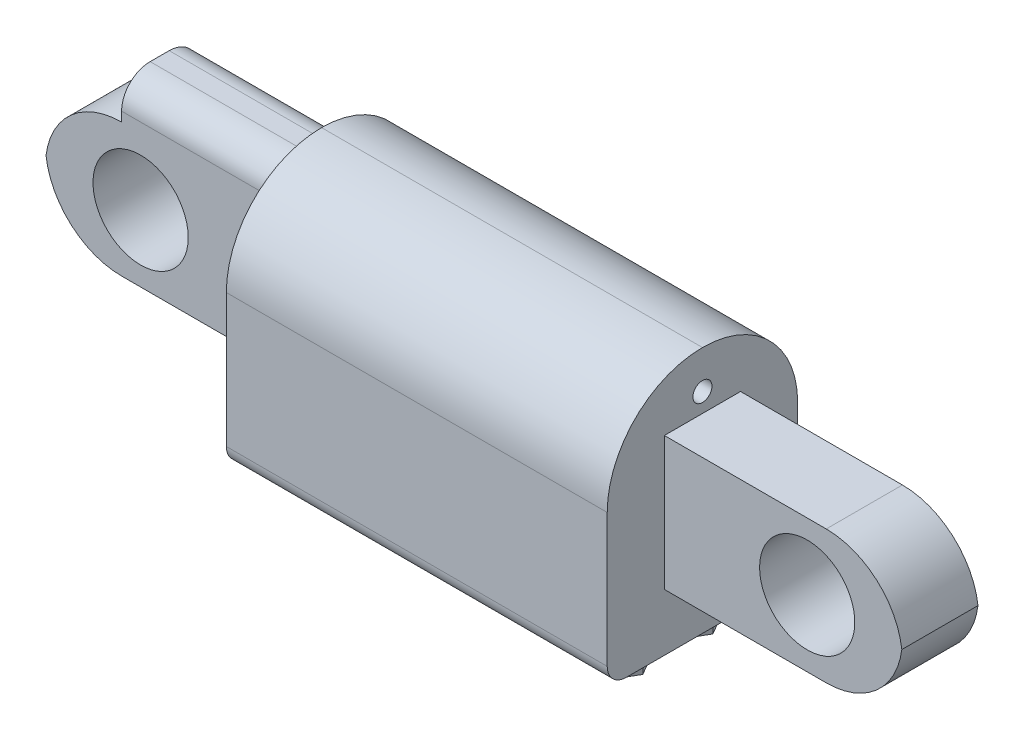
from build123d import *

# Parameters (mm, degrees)
SKETCH1_W           = 15.875
SKETCH1_H           = 8.89
SKETCH1_R           = 3.175
BOSS_EXTRUDE1_DEPTH = 5.08
FILLET1_R           = 5.08
SKETCH2_W           = 12.7
SKETCH2_H           = 16.51
SKETCH2_W_2         = 5.08
SKETCH2_H_2         = 8.89
BOSS_EXTRUDE2_DEPTH = 25.4
FILLET3_R           = 6.35
SKETCH3_W           = 10.795
SKETCH3_H           = 5.08
BOSS_EXTRUDE3_DEPTH = 2.54
SKETCH4_R           = 0.635
CUT_EXTRUDE1_DEPTH  = 54.425782953
FILLET6_R           = 1.27
BOSS_EXTRUDE7_DEPTH = 0.381
FILLET7_R           = 1.905


# Some blends are built 0.0001 mm under size
with BuildPart() as part:
    # Sketch1 → Boss-Extrude1 (new body)
    with BuildSketch(Plane.XY):
        with Locations((1.5875, 0)):
            Rectangle(SKETCH1_W, SKETCH1_H)
        Circle(SKETCH1_R, mode=Mode.SUBTRACT)
    extrude(amount=BOSS_EXTRUDE1_DEPTH)

    # Fillet1
    # the kernel refuses this fillet: 5.08 mm, written as the material it takes off along each edge
    with BuildSketch(Plane(origin=(-6.35, -4.445, -12.7), x_dir=(1, 0, 0), z_dir=(0, 0, 1))) as fillet1_piece_1:
        with BuildLine():
            CenterArc((FILLET1_R, FILLET1_R), FILLET1_R, 180, 90)
            Line((0, FILLET1_R), (0, 0))
            Line((0, 0), (FILLET1_R, 0))
        make_face()
    extrude(amount=30.48, mode=Mode.SUBTRACT)
    with BuildSketch(Plane(origin=(-6.35, 4.445, -12.7), x_dir=(1, 0, 0), z_dir=(0, 0, 1))) as fillet1_piece_2:
        with BuildLine():
            CenterArc((FILLET1_R, -FILLET1_R), FILLET1_R, 90, 90)
            Line((0, -FILLET1_R), (0, 0))
            Line((0, 0), (FILLET1_R, 0))
        make_face()
    extrude(amount=30.48, mode=Mode.SUBTRACT)


with BuildPart() as body_2:
    # Sketch2 → Boss-Extrude2 (new body)
    # profile 1 of 3: a face of its own
    with BuildSketch(Plane(origin=(9.525, 0, 0), x_dir=(0, 0, -1), z_dir=(1, 0, 0))):
        with Locations((-2.54, 0)):
            Rectangle(SKETCH2_W, SKETCH2_H)
        with Locations((-2.54, 0)):
            Rectangle(SKETCH2_W_2, SKETCH2_H_2, mode=Mode.SUBTRACT)
    # profile 2 of 3: a face of its own
    with BuildSketch(Plane(origin=(9.525, 0, 0), x_dir=(0, 0, -1), z_dir=(1, 0, 0))):
        with Locations((-2.54, 0)):
            Rectangle(SKETCH2_W_2, SKETCH2_H_2)
    # profile 3 of 3: a face of its own
    with BuildSketch(Plane(origin=(9.525, 0, 0), x_dir=(0, 0, -1), z_dir=(1, 0, 0))):
        with Locations((-2.54, 0)):
            Rectangle(SKETCH2_W_2, SKETCH2_H_2)
    extrude(amount=BOSS_EXTRUDE2_DEPTH)

    # Fillet3
    fillet3_edges = [body_2.edges().sort_by_distance(p)[0] for p in [
        (22.225, 8.255, -3.81),
        (22.225, 8.255, 8.89),
    ]]
    fillet(fillet3_edges, radius=FILLET3_R - 0.0001)  # a hair under: the kernel refuses the full size


with BuildPart() as body_3:
    # Mirror7: mirrored copy
    add(part.part.mirror(Plane.ZY.offset(-22.225)))


with BuildPart() as part_1:
    add(part.part)

    add(body_2.part)  # Boss-Extrude3 merges body 2
    # Sketch3 → Boss-Extrude3 (add)
    with BuildSketch(Plane(origin=(0, 4.445, 0), x_dir=(1, 0, 0), z_dir=(0, 1, 0))):
        with Locations((4.1275, -2.54)):
            Rectangle(SKETCH3_W, SKETCH3_H)
    extrude(amount=BOSS_EXTRUDE3_DEPTH)

    # Sketch4 → Cut-Extrude1 (cut, through all)
    with BuildSketch(Plane.ZY.offset(1.27)):
        with Locations(Location((2.54, 5.715, 0), (0, 0, 270))):
            Circle(SKETCH4_R)
    extrude(amount=-CUT_EXTRUDE1_DEPTH, mode=Mode.SUBTRACT)

    # Fillet6
    fillet6_edges = [part_1.edges().sort_by_distance(p)[0] for p in [
        (22.225, -8.255, 8.89),
        (22.225, -8.255, -3.81),
    ]]
    fillet(fillet6_edges, radius=FILLET6_R)

    # Sketch5 → Boss-Extrude7 (add)
    with BuildSketch(Plane.XZ.offset(8.255)):
        Polygon((34.925, 6.520147737), (34.29, 7.62), (33.02, 7.62), (32.385, 6.520147737), (33.02, 5.420295474), (34.29, 5.420295474), align=None)
        Polygon((29.845, 6.520147737), (29.21, 7.62), (27.94, 7.62), (27.305, 6.520147737), (27.94, 5.420295474), (29.21, 5.420295474), align=None)
        Polygon((24.765, 6.520147737), (24.13, 7.62), (22.86, 7.62), (22.225, 6.520147737), (22.86, 5.420295474), (24.13, 5.420295474), align=None)
        Polygon((19.685, 6.520147737), (19.05, 7.62), (17.78, 7.62), (17.145, 6.520147737), (17.78, 5.420295474), (19.05, 5.420295474), align=None)
        Polygon((14.605, 6.520147737), (13.97, 7.62), (12.7, 7.62), (12.065, 6.520147737), (12.7, 5.420295474), (13.97, 5.420295474), align=None)
        Polygon((30.48, 3.083495474), (31.75, 3.083495474), (32.385, 4.183347737), (31.75, 5.2832), (30.48, 5.2832), (29.845, 4.183347737), align=None)
        Polygon((25.4, 3.083495474), (26.67, 3.083495474), (27.305, 4.183347737), (26.67, 5.2832), (25.4, 5.2832), (24.765, 4.183347737), align=None)
        Polygon((20.32, 3.083495474), (21.59, 3.083495474), (22.225, 4.183347737), (21.59, 5.2832), (20.32, 5.2832), (19.685, 4.183347737), align=None)
        Polygon((15.24, 3.083495474), (16.51, 3.083495474), (17.145, 4.183347737), (16.51, 5.2832), (15.24, 5.2832), (14.605, 4.183347737), align=None)
        Polygon((10.16, 3.083495474), (11.43, 3.083495474), (12.065, 4.183347737), (11.43, 5.2832), (10.16, 5.2832), (9.525, 4.183347737), align=None)
        Polygon((33.02, 0.746695474), (34.29, 0.746695474), (34.925, 1.846547737), (34.29, 2.9464), (33.02, 2.9464), (32.385, 1.846547737), align=None)
        Polygon((27.94, 0.746695474), (29.21, 0.746695474), (29.845, 1.846547737), (29.21, 2.9464), (27.94, 2.9464), (27.305, 1.846547737), align=None)
        Polygon((22.86, 0.746695474), (24.13, 0.746695474), (24.765, 1.846547737), (24.13, 2.9464), (22.86, 2.9464), (22.225, 1.846547737), align=None)
        Polygon((17.78, 0.746695474), (19.05, 0.746695474), (19.685, 1.846547737), (19.05, 2.9464), (17.78, 2.9464), (17.145, 1.846547737), align=None)
        Polygon((12.7, 0.746695474), (13.97, 0.746695474), (14.605, 1.846547737), (13.97, 2.9464), (12.7, 2.9464), (12.065, 1.846547737), align=None)
        Polygon((30.48, -1.590104526), (31.75, -1.590104526), (32.385, -0.490252263), (31.75, 0.6096), (30.48, 0.6096), (29.845, -0.490252263), align=None)
        Polygon((25.4, -1.590104526), (26.67, -1.590104526), (27.305, -0.490252263), (26.67, 0.6096), (25.4, 0.6096), (24.765, -0.490252263), align=None)
        Polygon((20.32, -1.590104526), (21.59, -1.590104526), (22.225, -0.490252263), (21.59, 0.6096), (20.32, 0.6096), (19.685, -0.490252263), align=None)
        Polygon((15.24, -1.590104526), (16.51, -1.590104526), (17.145, -0.490252263), (16.51, 0.6096), (15.24, 0.6096), (14.605, -0.490252263), align=None)
        Polygon((10.16, -1.590104526), (11.43, -1.590104526), (12.065, -0.490252263), (11.43, 0.6096), (10.16, 0.6096), (9.525, -0.490252263), align=None)
    extrude(amount=BOSS_EXTRUDE7_DEPTH)

    # Fillet7
    fillet7_edges = [part_1.edges().sort_by_distance(p)[0] for p in [
        (4.1275, 6.985, 0),
        (4.1275, 6.985, 5.08),
    ]]
    fillet(fillet7_edges, radius=FILLET7_R)


solid = Compound([body_3.part, part_1.part])
